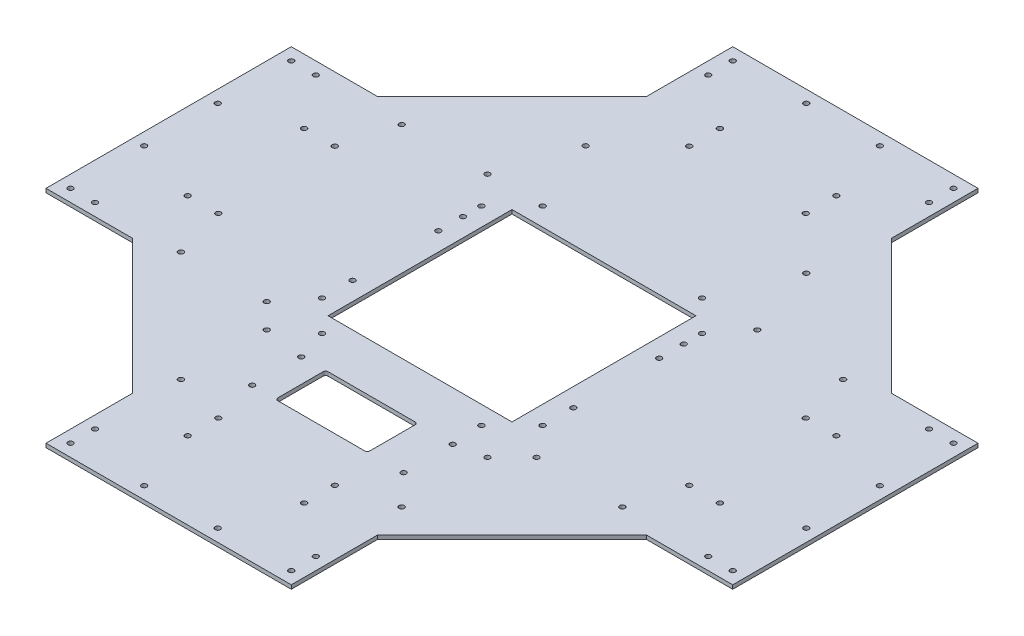
from build123d import *

# Parameters (mm, degrees)
SKETCH1_R           = 2.125
BOSS_EXTRUDE1_DEPTH = 3.175
SKETCH2_R           = 2.125
SKETCH2_R_2         = 2.1
SKETCH2_W           = 150
SKETCH2_H           = 150
SKETCH2_W_2         = 75
SKETCH2_H_2         = 41
CUT_EXTRUDE1_DEPTH  = 396.992525971
FILLET1_R           = 2


with BuildPart() as part:
    # Sketch1 → Boss-Extrude1 (new body)
    with BuildSketch(Plane(origin=(0, 0, 0), x_dir=(1, 0, 0), z_dir=(0, 1, 0))):
        Polygon((-100, -280), (0, -280), (100, -280), (100, -209.601551084), (209.601551084, -100), (280, -100), (280, 0), (280, 100), (209.601551084, 100), (100, 209.601551084), (100, 280), (0, 280), (-100, 280), (-100, 209.601551084), (-209.601551084, 100), (-280, 100), (-280, 0), (-280, -100), (-209.601551084, -100), (-100, -209.601551084), align=None)
        with Locations((-90, -270)):
            Circle(SKETCH1_R, mode=Mode.SUBTRACT)
        with Locations((-90, -250)):
            Circle(SKETCH1_R, mode=Mode.SUBTRACT)
        with Locations((-30, -270)):
            Circle(SKETCH1_R, mode=Mode.SUBTRACT)
        with Locations((-47.5, -217)):
            Circle(SKETCH1_R, mode=Mode.SUBTRACT)
        with Locations((-90, -180)):
            Circle(SKETCH1_R, mode=Mode.SUBTRACT)
        with Locations((-47.5, -192)):
            Circle(SKETCH1_R, mode=Mode.SUBTRACT)
        with Locations((-270, -90)):
            Circle(SKETCH1_R, mode=Mode.SUBTRACT)
        with Locations((-250, -90)):
            Circle(SKETCH1_R, mode=Mode.SUBTRACT)
        with Locations((-180, -90)):
            Circle(SKETCH1_R, mode=Mode.SUBTRACT)
        with Locations((-217, -47.5)):
            Circle(SKETCH1_R, mode=Mode.SUBTRACT)
        with Locations((-270, -30)):
            Circle(SKETCH1_R, mode=Mode.SUBTRACT)
        with Locations((-192, -47.5)):
            Circle(SKETCH1_R, mode=Mode.SUBTRACT)
        with Locations((-90, -110)):
            Circle(SKETCH1_R, mode=Mode.SUBTRACT)
        with Locations((-110, -90)):
            Circle(SKETCH1_R, mode=Mode.SUBTRACT)
        with Locations((-90, -40)):
            Circle(SKETCH1_R, mode=Mode.SUBTRACT)
        with Locations((30, -270)):
            Circle(SKETCH1_R, mode=Mode.SUBTRACT)
        with Locations((47.5, -217)):
            Circle(SKETCH1_R, mode=Mode.SUBTRACT)
        with Locations((90, -270)):
            Circle(SKETCH1_R, mode=Mode.SUBTRACT)
        with Locations((90, -250)):
            Circle(SKETCH1_R, mode=Mode.SUBTRACT)
        with Locations((47.5, -192)):
            Circle(SKETCH1_R, mode=Mode.SUBTRACT)
        with Locations((90, -180)):
            Circle(SKETCH1_R, mode=Mode.SUBTRACT)
        with Locations((90, -110)):
            Circle(SKETCH1_R, mode=Mode.SUBTRACT)
        with Locations((110, -90)):
            Circle(SKETCH1_R, mode=Mode.SUBTRACT)
        with Locations((90, -40)):
            Circle(SKETCH1_R, mode=Mode.SUBTRACT)
        with Locations((180, -90)):
            Circle(SKETCH1_R, mode=Mode.SUBTRACT)
        with Locations((250, -90)):
            Circle(SKETCH1_R, mode=Mode.SUBTRACT)
        with Locations((270, -90)):
            Circle(SKETCH1_R, mode=Mode.SUBTRACT)
        with Locations((192, -47.5)):
            Circle(SKETCH1_R, mode=Mode.SUBTRACT)
        with Locations((217, -47.5)):
            Circle(SKETCH1_R, mode=Mode.SUBTRACT)
        with Locations((270, -30)):
            Circle(SKETCH1_R, mode=Mode.SUBTRACT)
        with Locations((-270, 30)):
            Circle(SKETCH1_R, mode=Mode.SUBTRACT)
        with Locations((-217, 47.5)):
            Circle(SKETCH1_R, mode=Mode.SUBTRACT)
        with Locations((-192, 47.5)):
            Circle(SKETCH1_R, mode=Mode.SUBTRACT)
        with Locations((-270, 90)):
            Circle(SKETCH1_R, mode=Mode.SUBTRACT)
        with Locations((-250, 90)):
            Circle(SKETCH1_R, mode=Mode.SUBTRACT)
        with Locations((-180, 90)):
            Circle(SKETCH1_R, mode=Mode.SUBTRACT)
        with Locations((-90, 30)):
            Circle(SKETCH1_R, mode=Mode.SUBTRACT)
        with Locations((-90, 50)):
            Circle(SKETCH1_R, mode=Mode.SUBTRACT)
        with Locations((-110, 90)):
            Circle(SKETCH1_R, mode=Mode.SUBTRACT)
        with Locations((-90, 150)):
            Circle(SKETCH1_R, mode=Mode.SUBTRACT)
        with Locations((-47.5, 192)):
            Circle(SKETCH1_R, mode=Mode.SUBTRACT)
        with Locations((-90, 250)):
            Circle(SKETCH1_R, mode=Mode.SUBTRACT)
        with Locations((-90, 270)):
            Circle(SKETCH1_R, mode=Mode.SUBTRACT)
        with Locations((-47.5, 217)):
            Circle(SKETCH1_R, mode=Mode.SUBTRACT)
        with Locations((-30, 270)):
            Circle(SKETCH1_R, mode=Mode.SUBTRACT)
        with Locations((90, 30)):
            Circle(SKETCH1_R, mode=Mode.SUBTRACT)
        with Locations((90, 50)):
            Circle(SKETCH1_R, mode=Mode.SUBTRACT)
        with Locations((110, 90)):
            Circle(SKETCH1_R, mode=Mode.SUBTRACT)
        with Locations((192, 47.5)):
            Circle(SKETCH1_R, mode=Mode.SUBTRACT)
        with Locations((270, 30)):
            Circle(SKETCH1_R, mode=Mode.SUBTRACT)
        with Locations((217, 47.5)):
            Circle(SKETCH1_R, mode=Mode.SUBTRACT)
        with Locations((180, 90)):
            Circle(SKETCH1_R, mode=Mode.SUBTRACT)
        with Locations((250, 90)):
            Circle(SKETCH1_R, mode=Mode.SUBTRACT)
        with Locations((270, 90)):
            Circle(SKETCH1_R, mode=Mode.SUBTRACT)
        with Locations((47.5, 192)):
            Circle(SKETCH1_R, mode=Mode.SUBTRACT)
        with Locations((90, 150)):
            Circle(SKETCH1_R, mode=Mode.SUBTRACT)
        with Locations((47.5, 217)):
            Circle(SKETCH1_R, mode=Mode.SUBTRACT)
        with Locations((30, 270)):
            Circle(SKETCH1_R, mode=Mode.SUBTRACT)
        with Locations((90, 250)):
            Circle(SKETCH1_R, mode=Mode.SUBTRACT)
        with Locations((90, 270)):
            Circle(SKETCH1_R, mode=Mode.SUBTRACT)
    extrude(amount=BOSS_EXTRUDE1_DEPTH)

    # Sketch2 → Cut-Extrude1 (cut, through all)
    with BuildSketch(Plane(origin=(0, 3.175, 0), x_dir=(1, 0, 0), z_dir=(0, 1, 0))):
        with Locations((66.6, -115)):
            Circle(SKETCH2_R)
        with Locations((-90, 65)):
            Circle(SKETCH2_R)
        with Locations((-90, -65)):
            Circle(SKETCH2_R)
        with Locations((90, -65)):
            Circle(SKETCH2_R)
        with Locations((90, 65)):
            Circle(SKETCH2_R)
        with Locations((-65, 90)):
            Circle(SKETCH2_R)
        with Locations((65, 90)):
            Circle(SKETCH2_R)
        with Locations((65, -90)):
            Circle(SKETCH2_R)
        with Locations((-65, -90)):
            Circle(SKETCH2_R)
        with Locations((66.6, -155)):
            Circle(SKETCH2_R)
        with Locations((-56.9, -115)):
            Circle(SKETCH2_R_2)
        with Locations((-56.9, -155)):
            Circle(SKETCH2_R_2)
        Rectangle(SKETCH2_W, SKETCH2_H)
        with Locations((0, -135)):
            Rectangle(SKETCH2_W_2, SKETCH2_H_2)
    extrude(amount=-CUT_EXTRUDE1_DEPTH, mode=Mode.SUBTRACT)

    # Fillet1
    fillet1_edges = [part.edges().sort_by_distance(p)[0] for p in [
        (-37.5, 1.5875, 155.5),
        (37.5, 1.5875, 155.5),
        (37.5, 1.5875, 114.5),
        (-37.5, 1.5875, 114.5),
    ]]
    fillet(fillet1_edges, radius=FILLET1_R)


solid = part.part
